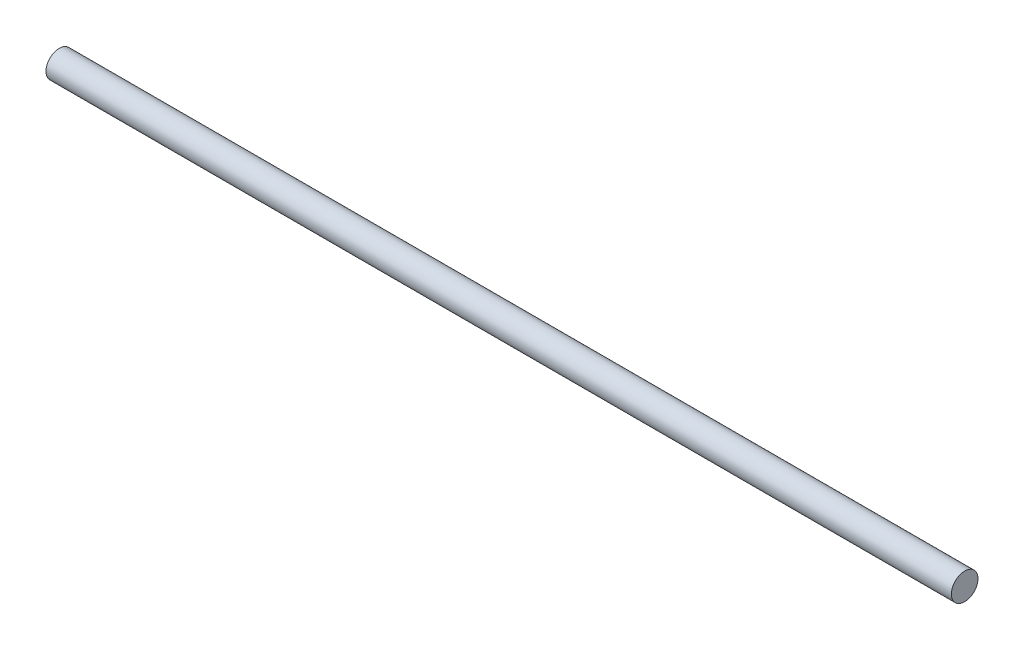
from build123d import *

# Parameters (mm, degrees)
SKETCH_1_R      = 60
EXTRUDE_1_DEPTH = 2040


with BuildPart() as part:
    # 草图1 → 凸台-拉伸1 (new, symmetric)
    with BuildSketch(Plane(origin=(0, 0, 0), x_dir=(0, 0, -1), z_dir=(1, 0, 0))):
        Circle(SKETCH_1_R)
    extrude(amount=EXTRUDE_1_DEPTH, both=True)


solid = part.part
